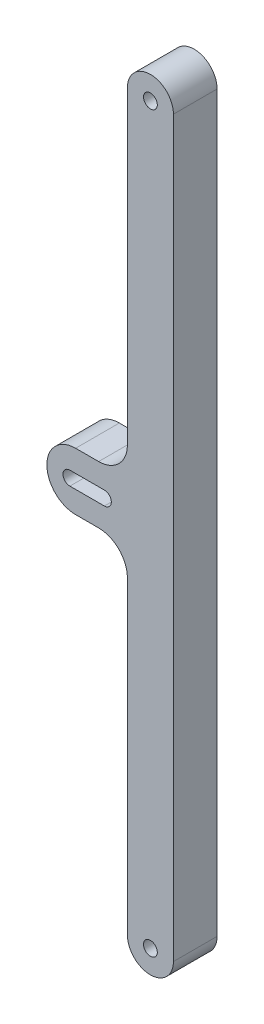
from build123d import *

# Parameters (mm, degrees)
SKETCH_1_R          = 2
SKETCH_1_R_2        = 0.6
EXTRUDE_1_DEPTH     = 3.8
SKETCH_2_W          = 4
SKETCH_2_H          = 3.8
EXTRUDE_2_DEPTH     = 10
SKETCH_1_4_R        = 0.6
CUT_EXTRUDE_1_DEPTH = 11.883014288
SKETCH_3_W          = 4
SKETCH_3_H          = 21.9
EXTRUDE_3_DEPTH     = 3.8
SKETCH_5_W          = 7
SKETCH_5_H          = 5
EXTRUDE_4_DEPTH     = 3.8
CUT_EXTRUDE_3_DEPTH = 67.521274792
FILLET_1_R          = 2.5


with BuildPart() as part:
    # 草图1 → 凸台-拉伸1 (new body)
    with BuildSketch(Plane.XY):
        with Locations(Location((0, 0, 0), (0, 0, 180))):
            Circle(SKETCH_1_R)
        Circle(SKETCH_1_R_2, mode=Mode.SUBTRACT)
    extrude(amount=EXTRUDE_1_DEPTH)

    # 草图2 → 凸台-拉伸2 (add)
    with BuildSketch(Plane(origin=(0, 0, 0), x_dir=(1, 0, 0), z_dir=(0, 1, 0))):
        with Locations((0, -1.9)):
            Rectangle(SKETCH_2_W, SKETCH_2_H)
    extrude(amount=-EXTRUDE_2_DEPTH)

    # 草图1<4> → 切除-拉伸1 (cut, through all)
    with BuildSketch(Plane.XY):
        Circle(SKETCH_1_4_R)
    extrude(amount=CUT_EXTRUDE_1_DEPTH, mode=Mode.SUBTRACT)

    # 草图3 → 凸台-拉伸3 (add)
    with BuildSketch(Plane.XY.offset(3.8)):
        with Locations((0, -20.95)):
            Rectangle(SKETCH_3_W, SKETCH_3_H)
    extrude(amount=-EXTRUDE_3_DEPTH)

    # 镜向1: part across plane


with BuildPart() as part_1:
    add(part.part)
    add(part.part.mirror(Plane(origin=(2, -31.9, -22.262299971), x_dir=(0, 0, 1), z_dir=(0, -1, 0))))

    # 草图5 → 凸台-拉伸4 (add)
    with BuildSketch(Plane.XY.offset(3.8)):
        with Locations((-5.5, -31.9)):
            Rectangle(SKETCH_5_W, SKETCH_5_H)
    extrude(amount=-EXTRUDE_4_DEPTH)

    # 草图6 → 切除-拉伸3 (cut, through all)
    with BuildSketch(Plane.XY.offset(3.8)):
        with BuildLine():
            Line((-4, -32.5), (-7, -32.5))
            ThreePointArc((-7, -32.5), (-7.6, -31.9), (-7, -31.3))
            Line((-7, -31.3), (-4, -31.3))
            ThreePointArc((-4, -31.3), (-3.4, -31.9), (-4, -32.5))
        make_face()
    extrude(amount=-CUT_EXTRUDE_3_DEPTH, mode=Mode.SUBTRACT)

    # 圆角1
    fillet_1_edges = [part_1.edges().sort_by_distance(p)[0] for p in [
        (-2, -29.4, 1.9),
        (-2, -34.4, 1.9),
    ]]
    fillet(fillet_1_edges, radius=FILLET_1_R)
    fillet_1_2_edges = [part_1.edges().sort_by_distance(p)[0] for p in [
        (-9, -34.4, 1.9),
        (-9, -29.4, 1.9),
    ]]
    fillet(fillet_1_2_edges, radius=FILLET_1_R - 0.0001)  # a hair under: the kernel refuses the full size


solid = part_1.part
